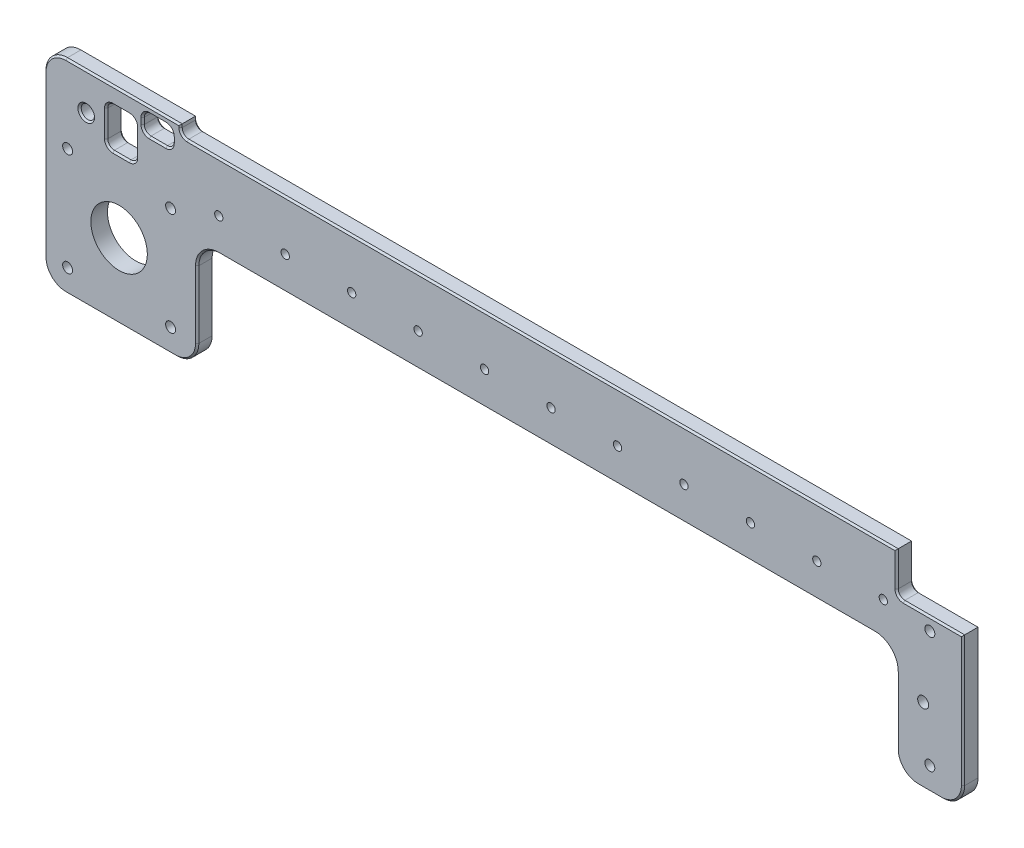
from build123d import *

# Parameters (mm, degrees)
SKETCH1_R           = 1.25
SKETCH1_R_2         = 8.5
SKETCH1_R_3         = 1.5
SKETCH1_R_4         = 1.65
SKETCH1_R_5         = 2
BOSS_EXTRUDE1_DEPTH = 5
CHAMFER1_SIZE       = 0.5


with BuildPart() as part:
    # Sketch1 → Boss-Extrude1 (new body)
    with BuildSketch(Plane.XY):
        with BuildLine():
            Line((0, -10), (197.5, -10))
            ThreePointArc((197.5, -10), (202.096194078, -11.903805922), (204, -16.5))
            Line((204, -16.5), (204, -36.746197724))
            ThreePointArc((204, -36.746197724), (205.903805922, -41.342391801), (210.5, -43.246197724))
            Line((210.5, -43.246197724), (217.5, -43.246197724))
            ThreePointArc((217.5, -43.246197724), (222.096194078, -41.342391801), (224, -36.746197724))
            Line((224, -36.746197724), (224, 2.55))
            Line((224, 2.55), (206, 2.55))
            ThreePointArc((206, 2.55), (204.585786438, 3.135786438), (204, 4.55))
            Line((204, 4.55), (204, 15))
            Line((204, 15), (-9.5, 15))
            ThreePointArc((-9.5, 15), (-10.914213562, 15.585786438), (-11.5, 17))
            Line((-11.5, 17), (-11.5, 18))
            Line((-11.5, 18), (-46, 18))
            ThreePointArc((-46, 18), (-50.596194078, 16.096194078), (-52.5, 11.5))
            Line((-52.5, 11.5), (-52.5, -36.746197724))
            ThreePointArc((-52.5, -36.746197724), (-50.596194078, -41.342391801), (-46, -43.246197724))
            Line((-46, -43.246197724), (-13, -43.246197724))
            ThreePointArc((-13, -43.246197724), (-8.403805922, -41.342391801), (-6.5, -36.746197724))
            Line((-6.5, -36.746197724), (-6.5, -16.5))
            ThreePointArc((-6.5, -16.5), (-4.596194078, -11.903805922), (0, -10))
        make_face()
        Circle(SKETCH1_R, mode=Mode.SUBTRACT)
        with Locations((20, 0)):
            Circle(SKETCH1_R, mode=Mode.SUBTRACT)
        with Locations((40, 0)):
            Circle(SKETCH1_R, mode=Mode.SUBTRACT)
        with Locations((60, 0)):
            Circle(SKETCH1_R, mode=Mode.SUBTRACT)
        with Locations((80, 0)):
            Circle(SKETCH1_R, mode=Mode.SUBTRACT)
        with Locations((100, 0)):
            Circle(SKETCH1_R, mode=Mode.SUBTRACT)
        with Locations((120, 0)):
            Circle(SKETCH1_R, mode=Mode.SUBTRACT)
        with Locations((140, 0)):
            Circle(SKETCH1_R, mode=Mode.SUBTRACT)
        with Locations((160, 0)):
            Circle(SKETCH1_R, mode=Mode.SUBTRACT)
        with Locations((180, 0)):
            Circle(SKETCH1_R, mode=Mode.SUBTRACT)
        with Locations((-30, -20.746197724)):
            Circle(SKETCH1_R_2, mode=Mode.SUBTRACT)
        with Locations((-45.5, -5.246197724)):
            Circle(SKETCH1_R_3, mode=Mode.SUBTRACT)
        with Locations((-14.5, -5.246197724)):
            Circle(SKETCH1_R_3, mode=Mode.SUBTRACT)
        with Locations((-45.5, -36.246197724)):
            Circle(SKETCH1_R_3, mode=Mode.SUBTRACT)
        with Locations((-14.5, -36.246197724)):
            Circle(SKETCH1_R_3, mode=Mode.SUBTRACT)
        with Locations((200, 0)):
            Circle(SKETCH1_R, mode=Mode.SUBTRACT)
        with Locations((212, -20.746197724)):
            Circle(SKETCH1_R_4, mode=Mode.SUBTRACT)
        with Locations((214, -36.246197724)):
            Circle(SKETCH1_R_3, mode=Mode.SUBTRACT)
        with Locations((214, -1.246197724)):
            Circle(SKETCH1_R_3, mode=Mode.SUBTRACT)
        with Locations((-39.9, 6.9)):
            Circle(SKETCH1_R_5, mode=Mode.SUBTRACT)
        with BuildLine():
            Line((-20.9, 16), (-15.9, 16))
            ThreePointArc((-15.9, 16), (-14.485786438, 15.414213562), (-13.9, 14))
            Line((-13.9, 14), (-13.9, 12.12))
            ThreePointArc((-13.9, 12.12), (-14.485786438, 10.705786438), (-15.9, 10.12))
            Line((-15.9, 10.12), (-20.9, 10.12))
            ThreePointArc((-20.9, 10.12), (-22.314213562, 10.705786438), (-22.9, 12.12))
            Line((-22.9, 12.12), (-22.9, 14))
            ThreePointArc((-22.9, 14), (-22.314213562, 15.414213562), (-20.9, 16))
        make_face(mode=Mode.SUBTRACT)
        with BuildLine():
            Line((-26.9, 12.9), (-31.9, 12.9))
            ThreePointArc((-31.9, 12.9), (-33.314213562, 12.314213562), (-33.9, 10.9))
            Line((-33.9, 10.9), (-33.9, 2.9))
            ThreePointArc((-33.9, 2.9), (-33.314213562, 1.485786438), (-31.9, 0.9))
            Line((-31.9, 0.9), (-26.9, 0.9))
            ThreePointArc((-26.9, 0.9), (-25.485786438, 1.485786438), (-24.9, 2.9))
            Line((-24.9, 2.9), (-24.9, 10.9))
            ThreePointArc((-24.9, 10.9), (-25.485786438, 12.314213562), (-26.9, 12.9))
        make_face(mode=Mode.SUBTRACT)
    extrude(amount=BOSS_EXTRUDE1_DEPTH)

    # Chamfer1
    chamfer1_edges = [part.edges().sort_by_distance(p)[0] for p in [
        (98.75, -10, 0),
        (-4.596194078, -11.903805922, 0),
        (-6.5, -26.623098862, 0),
        (-8.403805922, -41.342391801, 0),
        (-29.5, -43.246197724, 0),
        (-52.5, -12.623098862, 0),
        (98.75, -10, 5),
        (-4.596194078, -11.903805922, 5),
        (-6.5, -26.623098862, 5),
        (-8.403805922, -41.342391801, 5),
        (-29.5, -43.246197724, 5),
        (-52.5, -12.623098862, 5),
        (224, -17.098098862, 0),
        (222.096194078, -41.342391801, 0),
        (214, -43.246197724, 0),
        (205.903805922, -41.342391801, 0),
        (204, -26.623098862, 0),
        (202.096194078, -11.903805922, 0),
        (224, -17.098098862, 5),
        (222.096194078, -41.342391801, 5),
        (214, -43.246197724, 5),
        (205.903805922, -41.342391801, 5),
        (204, -26.623098862, 5),
        (202.096194078, -11.903805922, 5),
        (-28.75, 18, 0),
        (-28.75, 18, 5),
        (-50.596194078, 16.096194078, 0),
        (-50.596194078, 16.096194078, 5),
        (-11.5, 17.5, 0),
        (97.25, 15, 0),
        (-11.5, 17.5, 5),
        (97.25, 15, 5),
        (-18.4, 16, 5),
        (-22.314213562, 15.414213562, 5),
        (-14.485786438, 15.414213562, 5),
        (-22.9, 13.06, 5),
        (-13.9, 13.06, 5),
        (-22.314213562, 10.705786438, 5),
        (-14.485786438, 10.705786438, 5),
        (-18.4, 10.12, 5),
        (-18.4, 16, 0),
        (-22.314213562, 15.414213562, 0),
        (-14.485786438, 15.414213562, 0),
        (-22.9, 13.06, 0),
        (-13.9, 13.06, 0),
        (-22.314213562, 10.705786438, 0),
        (-14.485786438, 10.705786438, 0),
        (-18.4, 10.12, 0),
        (-50.596194078, -41.342391801, 0),
        (-50.596194078, -41.342391801, 5),
        (-10.914213562, 15.585786438, 0),
        (-10.914213562, 15.585786438, 5),
        (204, 9.775, 5),
        (204.585786438, 3.135786438, 5),
        (215, 2.55, 5),
        (215, 2.55, 0),
        (204.585786438, 3.135786438, 0),
        (204, 9.775, 0),
        (-29.4, 12.9, 0),
        (-33.314213562, 12.314213562, 0),
        (-25.485786438, 12.314213562, 0),
        (-33.9, 6.9, 0),
        (-24.9, 6.9, 0),
        (-33.314213562, 1.485786438, 0),
        (-25.485786438, 1.485786438, 0),
        (-29.4, 0.9, 0),
        (-29.4, 12.9, 5),
        (-33.314213562, 12.314213562, 5),
        (-25.485786438, 12.314213562, 5),
        (-33.9, 6.9, 5),
        (-24.9, 6.9, 5),
        (-33.314213562, 1.485786438, 5),
        (-25.485786438, 1.485786438, 5),
        (-29.4, 0.9, 5),
        (-41.9, 6.9, 5),
        (-41.9, 6.9, 0),
    ]]
    chamfer(chamfer1_edges, length=CHAMFER1_SIZE)


solid = part.part
